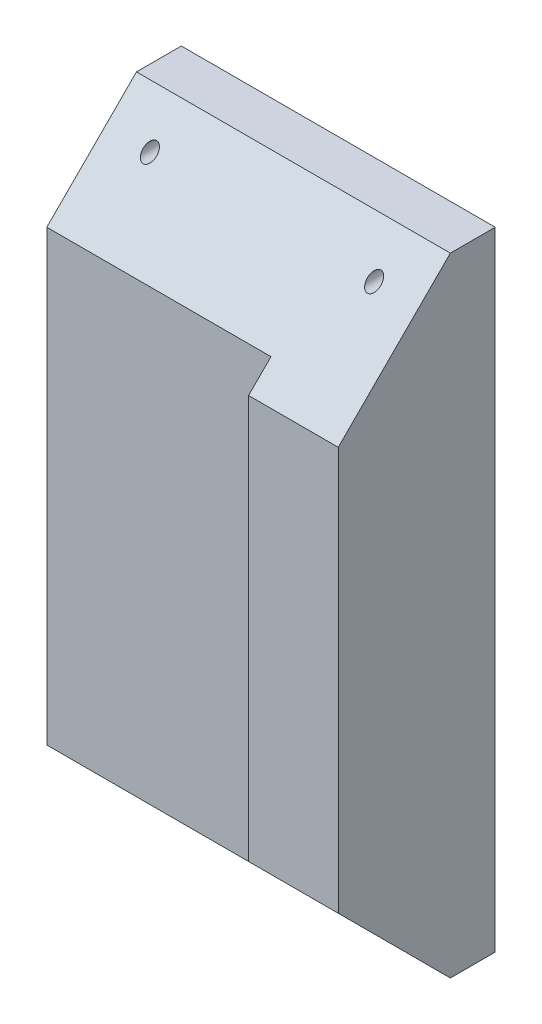
from build123d import *
from build123d.topology import SkipClean

# Parameters (mm, degrees)
SKETCH_1_W          = 70
SKETCH_1_H          = 140
EXTRUDE_1_DEPTH     = 10
SKETCH_2_W          = 50
SKETCH_2_H          = 100
EXTRUDE_2_DEPTH     = 20
CHAMFER_2_SIZE      = 20
CHAMFER_3_SIZE      = 20
SKETCH_3_W          = 20
SKETCH_3_H          = 140
EXTRUDE_3_DEPTH     = 25
CUT_EXTRUDE_1_DEPTH = 25
SKETCH_5_R          = 1.5
CUT_EXTRUDE_2_DEPTH = 25


with BuildPart() as part:
    # 草图1 → 凸台-拉伸1 (new body)
    with BuildSketch(Plane.XY):
        with Locations((-30.02391207, 29.079779473)):
            Rectangle(SKETCH_1_W, SKETCH_1_H)
    extrude(amount=EXTRUDE_1_DEPTH)

    # 草图2 → 凸台-拉伸2 (add)
    with BuildSketch(Plane.XY.offset(10)):
        with Locations((-40.02391207, 29.079779473)):
            Rectangle(SKETCH_2_W, SKETCH_2_H)
    extrude(amount=EXTRUDE_2_DEPTH)

    # 倒角2
    chamfer_2_edges = [part.edges().sort_by_distance(p)[0] for p in [
        (-40.02391207, -20.920220527, 10),
    ]]
    chamfer(chamfer_2_edges, length=CHAMFER_2_SIZE - 0.0001)  # a hair under: the kernel refuses the full size

    # 倒角3
    chamfer_3_edges = [part.edges().sort_by_distance(p)[0] for p in [
        (-40.02391207, 79.079779473, 10),
    ]]
    chamfer(chamfer_3_edges, length=CHAMFER_3_SIZE - 0.0001)  # a hair under: the kernel refuses the full size

    # 草图3 → 凸台-拉伸3 (add)
    with BuildSketch(Plane.XY.offset(10)):
        with Locations((-5.02391207, 29.079779473)):
            Rectangle(SKETCH_3_W, SKETCH_3_H)
    extrude(amount=EXTRUDE_3_DEPTH)

    # 草图4 → 切除-拉伸1 (cut)
    with SkipClean():  # the faces are left unmerged after this step: merging them gives an invalid solid
        with BuildSketch(Plane.ZY.offset(15.02391207)):
            Polygon((10, -40.920220527), (42.065793191, -8.854427336), (42.065793191, -55.280550519), align=None)
            Polygon((10, 99.079779473), (42.065793191, 67.013986282), (50.963251555, 103.923082266), align=None)
        extrude(amount=-CUT_EXTRUDE_1_DEPTH, mode=Mode.SUBTRACT)

    # 草图5 → 切除-拉伸2 (cut)
    with SkipClean():  # the faces are left unmerged after this step: merging them gives an invalid solid
        with BuildSketch(Plane(origin=(0, 0, 0), x_dir=(-1, 0, 0), z_dir=(0, 0, -1))):
            with Locations((5.02391207, 92.079779473)):
                Circle(SKETCH_5_R)
            with Locations((55.02391207, 92.079779473)):
                Circle(SKETCH_5_R)
            with Locations((5.02391207, -33.920220527)):
                Circle(SKETCH_5_R)
            with Locations((55.02391207, -33.920220527)):
                Circle(SKETCH_5_R)
        extrude(amount=-CUT_EXTRUDE_2_DEPTH, mode=Mode.SUBTRACT)


solid = part.part
